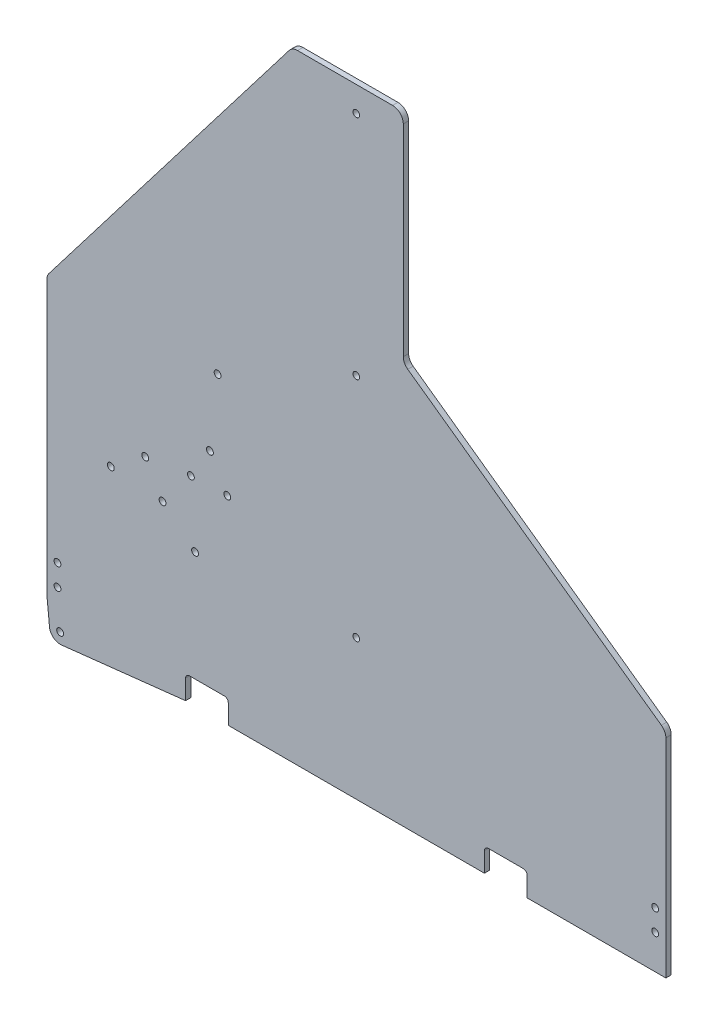
from build123d import *

# Parameters (mm, degrees)
SKETCH1_R           = 2.032
SKETCH1_R_2         = 2
BOSS_EXTRUDE1_DEPTH = 3.175
FILLET1_R           = 2.286
FILLET2_R           = 6.35


with BuildPart() as part:
    # Sketch1 → Boss-Extrude1 (new body)
    with BuildSketch(Plane.XY):
        with BuildLine():
            Line((8.639060666, -28.536126099), (82.55, -20.32))
            Line((82.55, -20.32), (82.55, -6.35))
            Line((82.55, -6.35), (107.95, -6.35))
            Line((107.95, -6.35), (107.95, -20.32))
            Line((107.95, -20.32), (260.35, -20.32))
            Line((260.35, -20.32), (260.35, -6.35))
            Line((260.35, -6.35), (285.75, -6.35))
            Line((285.75, -6.35), (285.75, -20.32))
            Line((285.75, -20.32), (368.3, -20.32))
            Line((368.3, -20.32), (368.3, 106.68))
            Line((368.3, 106.68), (212.09, 218.44))
            Line((212.09, 218.44), (212.09, 347.98))
            Line((212.09, 347.98), (184.15, 347.98))
            Line((184.15, 347.98), (146.05, 347.98))
            Line((146.05, 347.98), (0, 157.48))
            Line((0, 157.48), (0, 0))
            Line((0, 0), (0, -6.35))
            ThreePointArc((0, -6.35), (0.007883354, -6.666317007), (0.031513842, -6.981848616))
            Line((0.031513842, -6.981848616), (1.619013842, -22.856848616))
            ThreePointArc((1.619013842, -22.856848616), (3.943628298, -27.161748811), (8.639060666, -28.536126099))
        make_face()
        with Locations((7.9375, -22.225)):
            Circle(SKETCH1_R, mode=Mode.SUBTRACT)
        with Locations((6.35, 0)):
            Circle(SKETCH1_R, mode=Mode.SUBTRACT)
        with Locations((6.35, 12.7)):
            Circle(SKETCH1_R, mode=Mode.SUBTRACT)
        with Locations((88.216909404, 59.136578314)):
            Circle(SKETCH1_R, mode=Mode.SUBTRACT)
        with Locations((184.15, 62.98)):
            Circle(SKETCH1_R_2, mode=Mode.SUBTRACT)
        with Locations((38.1, 78.105)):
            Circle(SKETCH1_R, mode=Mode.SUBTRACT)
        with Locations((68.887329744, 75.518700365)):
            Circle(SKETCH1_R, mode=Mode.SUBTRACT)
        with Locations((58.568579744, 93.391299635)):
            Circle(SKETCH1_R, mode=Mode.SUBTRACT)
        with Locations((85.725, 97.155)):
            Circle(SKETCH1_R, mode=Mode.SUBTRACT)
        with Locations((107.382158942, 97.743700365)):
            Circle(SKETCH1_R, mode=Mode.SUBTRACT)
        with Locations((97.063408942, 115.616299635)):
            Circle(SKETCH1_R, mode=Mode.SUBTRACT)
        with Locations((101.6, 157.48)):
            Circle(SKETCH1_R, mode=Mode.SUBTRACT)
        with Locations((361.95, 0)):
            Circle(SKETCH1_R, mode=Mode.SUBTRACT)
        with Locations((361.95, 12.7)):
            Circle(SKETCH1_R, mode=Mode.SUBTRACT)
        with Locations((184.15, 197.98)):
            Circle(SKETCH1_R_2, mode=Mode.SUBTRACT)
        with Locations((184.15, 332.98)):
            Circle(SKETCH1_R_2, mode=Mode.SUBTRACT)
    extrude(amount=BOSS_EXTRUDE1_DEPTH)

    # Fillet1
    fillet1_edges = [part.edges().sort_by_distance(p)[0] for p in [
        (285.75, -6.35, 1.5875),
        (107.95, -6.35, 1.5875),
        (260.35, -6.35, 1.5875),
        (82.55, -6.35, 1.5875),
    ]]
    fillet(fillet1_edges, radius=FILLET1_R)

    # Fillet2
    fillet2_edges = [part.edges().sort_by_distance(p)[0] for p in [
        (0, 157.48, 1.5875),
        (212.09, 347.98, 1.5875),
        (212.09, 218.44, 1.5875),
        (368.3, 106.68, 1.5875),
        (146.05, 347.98, 1.5875),
    ]]
    fillet(fillet2_edges, radius=FILLET2_R)


solid = part.part
